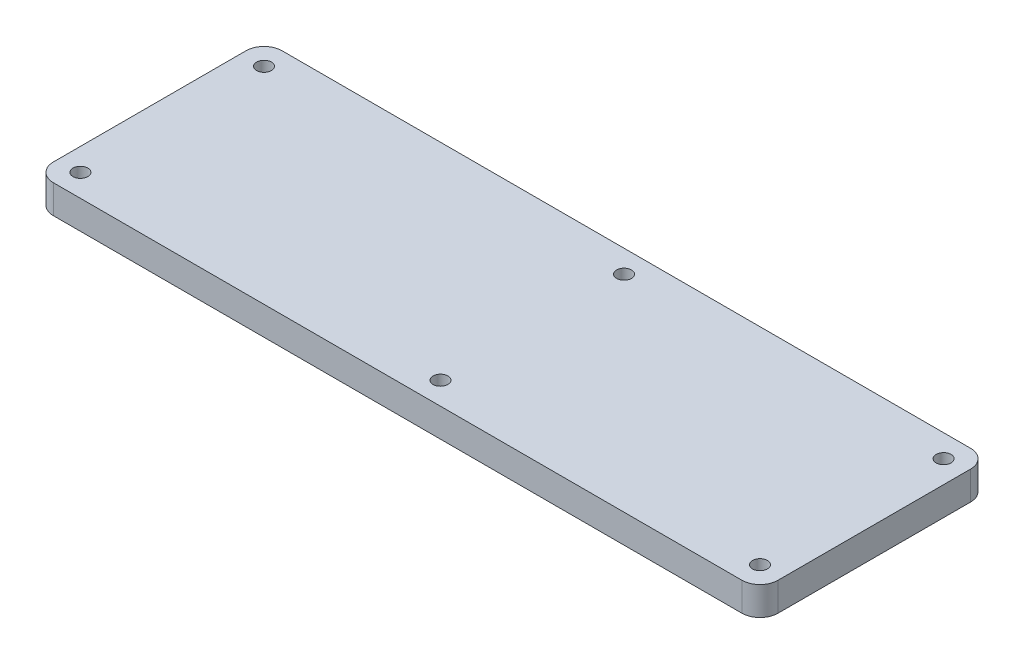
from build123d import *

# Parameters (mm, degrees)
SKETCH1_W             = 161
SKETCH1_H             = 50.8
BOSS_EXTRUDE1_DEPTH   = 6.35
FILLET1_R             = 4
M4X0_7_TAPPED_HOLE1_D = 3.3


with BuildPart() as part:
    # Sketch1 → Boss-Extrude1 (new body)
    with BuildSketch(Plane(origin=(0, 0, 0), x_dir=(1, 0, 0), z_dir=(0, 1, 0))):
        with Locations((34.088372112, 0.214238128)):
            Rectangle(SKETCH1_W, SKETCH1_H)
    extrude(amount=BOSS_EXTRUDE1_DEPTH)

    # Fillet1
    fillet1_edges = [part.edges().sort_by_distance(p)[0] for p in [
        (114.588372112, 3.175, 25.185761872),
        (114.588372112, 3.175, -25.614238128),
        (-46.411627888, 3.175, 25.185761872),
        (-46.411627888, 3.175, -25.614238128),
    ]]
    fillet(fillet1_edges, radius=FILLET1_R)

    # M4x0.7 Tapped Hole1 (through all)
    with Locations(Plane(origin=(0, 6.35, 0), x_dir=(1, 0, 0), z_dir=(0, 1, 0))):
        with Locations((-41.411627888, -20.185761872), (38.588372112, -20.185761872), (109.588372112, -20.185761872), (109.588372112, 20.614238128), (38.588372112, 20.614238128), (-41.411627888, 20.614238128)):
            Hole(M4X0_7_TAPPED_HOLE1_D / 2)


solid = part.part
